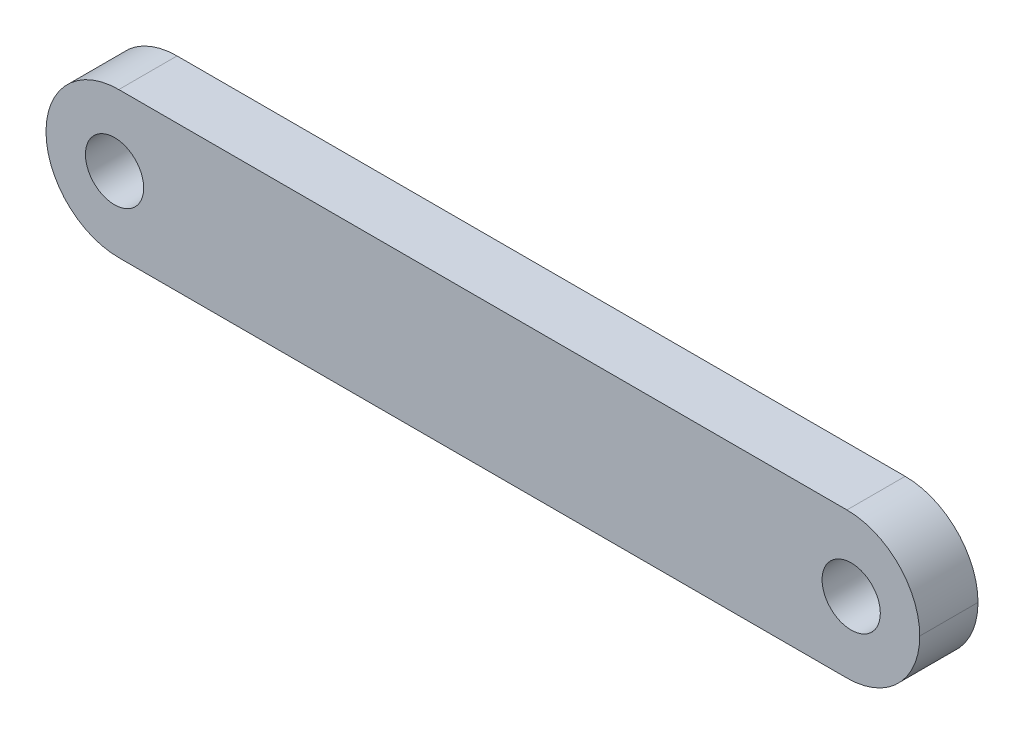
from build123d import *

# Parameters (mm, degrees)
SKETCH1_W           = 30
SKETCH1_H           = 5
SKETCH1_R           = 1
BOSS_EXTRUDE1_DEPTH = 2
FILLET1_R           = 2.5


with BuildPart() as part:
    # Sketch1 → Boss-Extrude1 (new body)
    with BuildSketch(Plane.XY):
        Rectangle(SKETCH1_W, SKETCH1_H)
        with Locations((12.646126356, 0)):
            Circle(SKETCH1_R, mode=Mode.SUBTRACT)
        with Locations(Location((-12.646126356, 0, 0), (0, 0, 180))):
            Circle(SKETCH1_R, mode=Mode.SUBTRACT)
    extrude(amount=BOSS_EXTRUDE1_DEPTH)

    # Fillet1
    fillet1_edges = [part.edges().sort_by_distance(p)[0] for p in [
        (-15, -2.5, 1),
        (-15, 2.5, 1),
        (15, -2.5, 1),
        (15, 2.5, 1),
    ]]
    fillet(fillet1_edges, radius=FILLET1_R - 0.0001)  # a hair under: the kernel refuses the full size


solid = part.part
